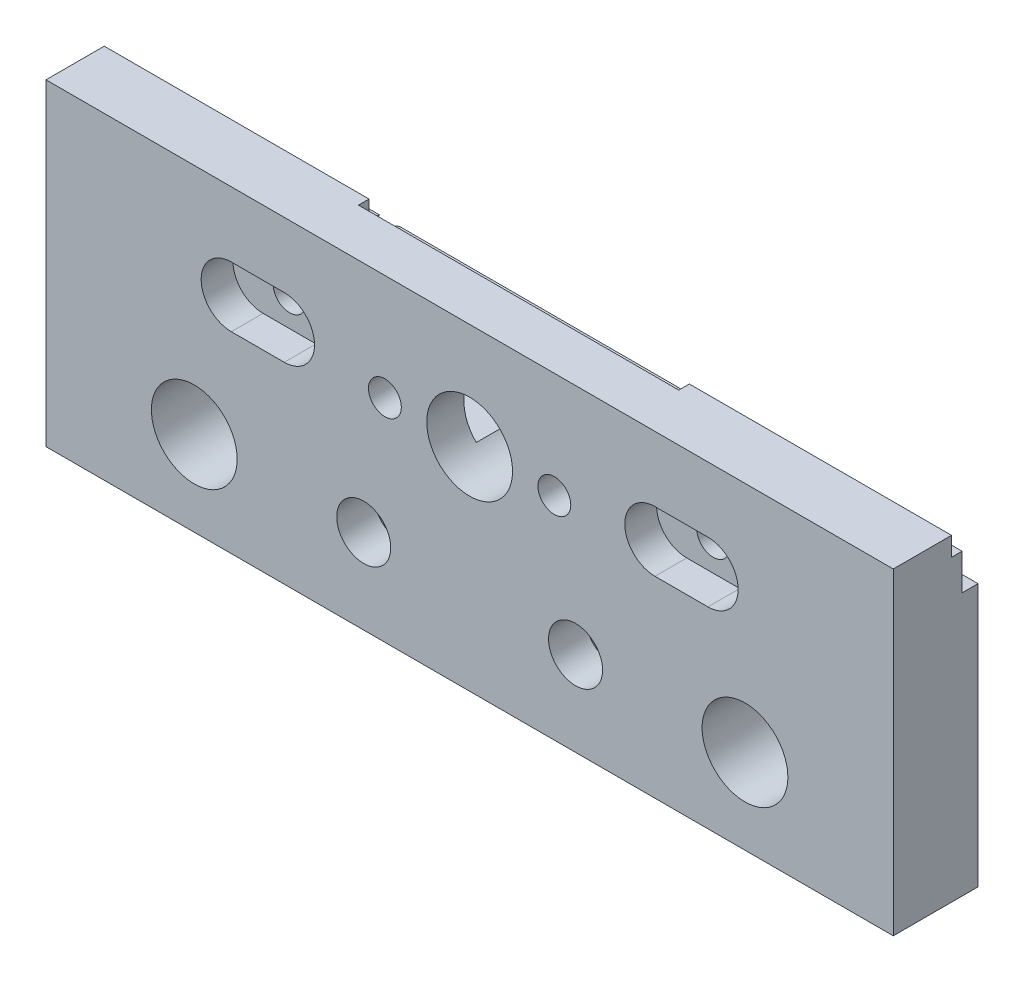
from build123d import *

# Parameters (mm, degrees)
SKETCH_2_W           = 80
SKETCH_2_H           = 30
SKETCH_2_R           = 4.05
EXTRUDE_1_DEPTH      = 8
SKETCH_3_R           = 2.55
CUT_EXTRUDE_1_DEPTH  = 86.813751812
CUT_EXTRUDE_2_DEPTH  = 86.813751812
SKETCH_5_R           = 1.55
CUT_EXTRUDE_3_DEPTH  = 86.813751812
CUT_EXTRUDE_4_DEPTH  = 4.5
CUT_EXTRUDE_5_DEPTH  = 4.5
SKETCH_11_R          = 1.55
CUT_EXTRUDE_7_DEPTH  = 86.813751812
CUT_EXTRUDE_8_DEPTH  = 3
CUT_EXTRUDE_START    = -3
CUT_EXTRUDE_9_DEPTH  = 3
CUT_EXTRUDE_11_DEPTH = 1


with BuildPart() as part:
    # 草图2 → 凸台-拉伸1 (new body)
    with BuildSketch(Plane.XY):
        with Locations((40, 15)):
            Rectangle(SKETCH_2_W, SKETCH_2_H)
        with Locations((14, 8)):
            Circle(SKETCH_2_R, mode=Mode.SUBTRACT)
        with Locations((40, 20)):
            Circle(SKETCH_2_R, mode=Mode.SUBTRACT)
        with Locations((66, 8)):
            Circle(SKETCH_2_R, mode=Mode.SUBTRACT)
    extrude(amount=EXTRUDE_1_DEPTH)

    # 草图3 → 切除-拉伸1 (cut, through all)
    with BuildSketch(Plane.XY.offset(8)):
        with Locations((30, 8)):
            Circle(SKETCH_3_R)
        with Locations((50, 8)):
            Circle(SKETCH_3_R)
    extrude(amount=-CUT_EXTRUDE_1_DEPTH, mode=Mode.SUBTRACT)

    # 草图4 → 切除-拉伸2 (cut, through all)
    with BuildSketch(Plane(origin=(80, 0, 0), x_dir=(0, 0, -1), z_dir=(1, 0, 0))):
        Polygon((-1.5, 28.2), (-2.5, 28.2), (-2.5, 30), (0, 30), (0, 24.8), (-1.5, 24.8), align=None)
    extrude(amount=-CUT_EXTRUDE_2_DEPTH, mode=Mode.SUBTRACT)

    # 草图5 → 切除-拉伸3 (cut, through all)
    with BuildSketch(Plane.XY.offset(8)):
        with Locations((48, 20)):
            Circle(SKETCH_5_R)
        with Locations((32, 20)):
            Circle(SKETCH_5_R)
    extrude(amount=-CUT_EXTRUDE_3_DEPTH, mode=Mode.SUBTRACT)

    # 草图7 → 切除-拉伸4 (cut)
    with BuildSketch(Plane(origin=(0, 0, 0), x_dir=(-1, 0, 0), z_dir=(0, 0, -1))):
        with BuildLine():
            Line((-54.05, 10), (-54.05, 2.5))
            ThreePointArc((-54.05, 2.5), (-54.782233047, 0.732233047), (-56.55, 0))
            Line((-56.55, 0), (-43.45, 0))
            ThreePointArc((-43.45, 0), (-45.217766953, 0.732233047), (-45.95, 2.5))
            Line((-45.95, 2.5), (-45.95, 10))
            ThreePointArc((-45.95, 10), (-50, 14.05), (-54.05, 10))
        make_face()
        with BuildLine():
            Line((-34.05, 10), (-34.05, 2.5))
            ThreePointArc((-34.05, 2.5), (-34.782233047, 0.732233047), (-36.55, 0))
            Line((-36.55, 0), (-23.45, 0))
            ThreePointArc((-23.45, 0), (-25.217766953, 0.732233047), (-25.95, 2.5))
            Line((-25.95, 2.5), (-25.95, 10))
            ThreePointArc((-25.95, 10), (-30, 14.05), (-34.05, 10))
        make_face()
    extrude(amount=-CUT_EXTRUDE_4_DEPTH, mode=Mode.SUBTRACT)

    # 草图8 → 切除-拉伸5 (cut)
    with BuildSketch(Plane(origin=(0, 0, 0), x_dir=(-1, 0, 0), z_dir=(0, 0, -1))):
        with BuildLine():
            Line((-30, 22.85), (-50, 22.85))
            ThreePointArc((-50, 22.85), (-52.85, 20), (-50, 17.15))
            Line((-50, 17.15), (-30, 17.15))
            ThreePointArc((-30, 17.15), (-27.15, 20), (-30, 22.85))
        make_face()
    extrude(amount=-CUT_EXTRUDE_5_DEPTH, mode=Mode.SUBTRACT)

    # 草图11 → 切除-拉伸7 (cut, through all)
    with BuildSketch(Plane(origin=(0, 0, 0), x_dir=(-1, 0, 0), z_dir=(0, 0, -1))):
        with Locations((-60, 21)):
            Circle(SKETCH_11_R)
        with Locations((-20, 21)):
            Circle(SKETCH_11_R)
    extrude(amount=-CUT_EXTRUDE_7_DEPTH, mode=Mode.SUBTRACT)

    # 草图12 → 切除-拉伸8 (cut)
    with BuildSketch(Plane(origin=(0, 0, 0), x_dir=(-1, 0, 0), z_dir=(0, 0, -1))):
        with BuildLine():
            Line((-62.5, 18.15), (-57.5, 18.15))
            ThreePointArc((-57.5, 18.15), (-54.65, 21), (-57.5, 23.85))
            Line((-57.5, 23.85), (-62.5, 23.85))
            ThreePointArc((-62.5, 23.85), (-65.35, 21), (-62.5, 18.15))
        make_face()
        with BuildLine():
            Line((-17.5, 23.85), (-22.5, 23.85))
            ThreePointArc((-22.5, 23.85), (-25.35, 21), (-22.5, 18.15))
            Line((-22.5, 18.15), (-17.5, 18.15))
            ThreePointArc((-17.5, 18.15), (-14.65, 21), (-17.5, 23.85))
        make_face()
    extrude(amount=-CUT_EXTRUDE_8_DEPTH, mode=Mode.SUBTRACT)

    # 草图15 → 切除-拉伸9 (cut)
    with BuildSketch(Plane.XY.offset(8).offset(CUT_EXTRUDE_START)):
        with BuildLine():
            Line((57.5, 18.15), (62.5, 18.15))
            ThreePointArc((62.5, 18.15), (65.35, 21), (62.5, 23.85))
            Line((62.5, 23.85), (57.5, 23.85))
            ThreePointArc((57.5, 23.85), (54.65, 21), (57.5, 18.15))
        make_face()
        with BuildLine():
            Line((22.5, 23.85), (17.5, 23.85))
            ThreePointArc((17.5, 23.85), (14.65, 21), (17.5, 18.15))
            Line((17.5, 18.15), (22.5, 18.15))
            ThreePointArc((22.5, 18.15), (25.35, 21), (22.5, 23.85))
        make_face()
    extrude(amount=CUT_EXTRUDE_9_DEPTH, mode=Mode.SUBTRACT)

    # 草图19 → 切除-拉伸11 (cut, symmetric)
    with BuildSketch(Plane(origin=(0, 0, 2.5), x_dir=(-1, 0, 0), z_dir=(0, 0, -1))):
        with BuildLine():
            Line((-25, 30), (-55.247938178, 30))
            Line((-55.247938178, 30), (-55.247938178, 28.391153453))
            ThreePointArc((-55.247938178, 28.391153453), (-55.369232945, 27.982216135), (-55.693884124, 27.705550702))
            ThreePointArc((-55.693884124, 27.705550702), (-55.732813419, 25.712631781), (-54.179572184, 26.961904762))
            ThreePointArc((-54.179572184, 26.961904762), (-53.995126165, 27.8172134), (-53.208330372, 28.2))
            Line((-53.208330372, 28.2), (-27.039607805, 28.2))
            ThreePointArc((-27.039607805, 28.2), (-26.252812013, 27.8172134), (-26.068365993, 26.961904762))
            ThreePointArc((-26.068365993, 26.961904762), (-24.515124759, 25.712631781), (-24.554054054, 27.705550702))
            ThreePointArc((-24.554054054, 27.705550702), (-24.878705233, 27.982216135), (-25, 28.391153453))
            Line((-25, 28.391153453), (-25, 30))
        make_face()
    extrude(amount=CUT_EXTRUDE_11_DEPTH, both=True, mode=Mode.SUBTRACT)


solid = part.part
